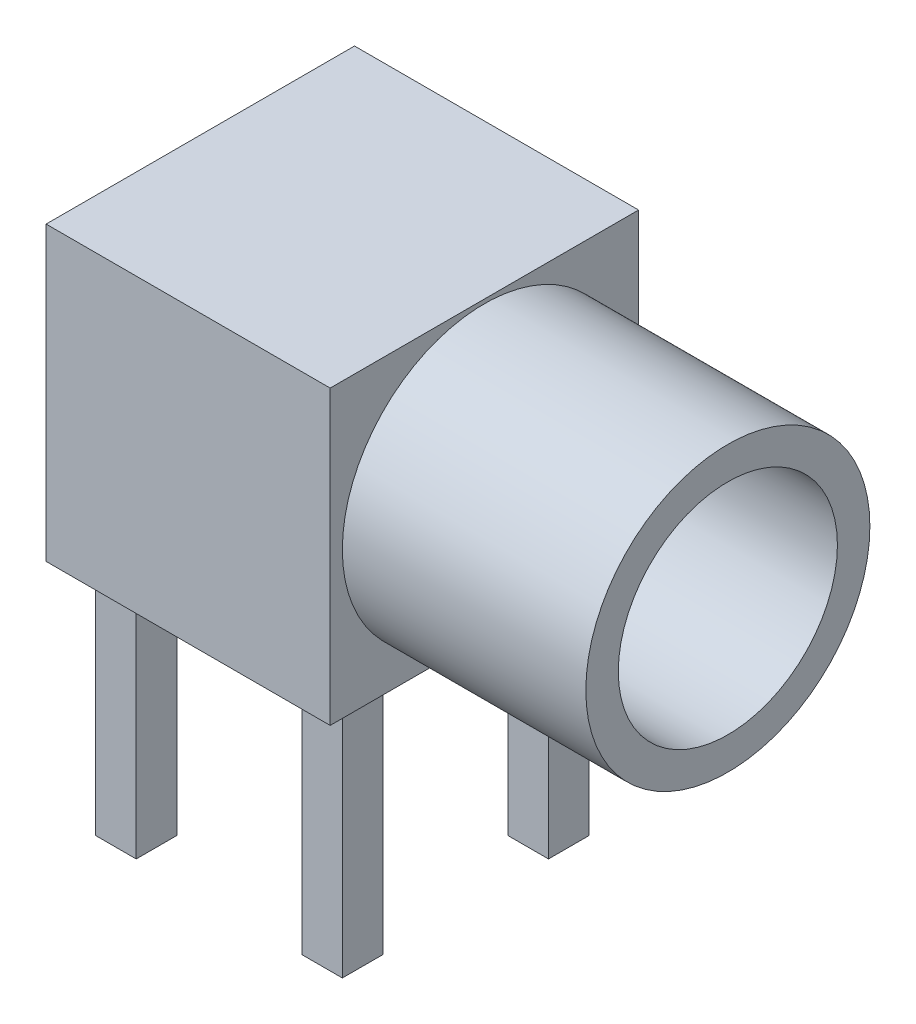
from build123d import *

# Parameters (mm, degrees)
SKETCH1_W           = 3.5
SKETCH1_H           = 3.8
BOSS_EXTRUDE1_DEPTH = 3.6
SKETCH2_R           = 1.75
SKETCH2_R_2         = 1.35
BOSS_EXTRUDE2_DEPTH = 3
SKETCH3_W           = 0.5
SKETCH3_H           = 0.5
BOSS_EXTRUDE3_DEPTH = 3


with BuildPart() as part:
    # Sketch1 → Boss-Extrude1 (new body)
    with BuildSketch(Plane(origin=(0, 0, 0), x_dir=(1, 0, 0), z_dir=(0, 1, 0))):
        Rectangle(SKETCH1_W, SKETCH1_H)
    extrude(amount=BOSS_EXTRUDE1_DEPTH)

    # Sketch2 → Boss-Extrude2 (add)
    with BuildSketch(Plane(origin=(1.75, 0, 0), x_dir=(0, 0, -1), z_dir=(1, 0, 0))):
        with Locations((0, 1.8)):
            Circle(SKETCH2_R)
        with Locations((0, 1.8)):
            Circle(SKETCH2_R_2, mode=Mode.SUBTRACT)
    extrude(amount=BOSS_EXTRUDE2_DEPTH)

    # Sketch3 → Boss-Extrude3 (add)
    with BuildSketch(Plane.XZ):
        with Locations((-1.27, 1.27)):
            Rectangle(SKETCH3_W, SKETCH3_H)
        with Locations((-1.27, -1.27)):
            Rectangle(SKETCH3_W, SKETCH3_H)
        with Locations((1.27, 1.27)):
            Rectangle(SKETCH3_W, SKETCH3_H)
        with Locations((1.27, -1.27)):
            Rectangle(SKETCH3_W, SKETCH3_H)
    extrude(amount=BOSS_EXTRUDE3_DEPTH)


solid = part.part
